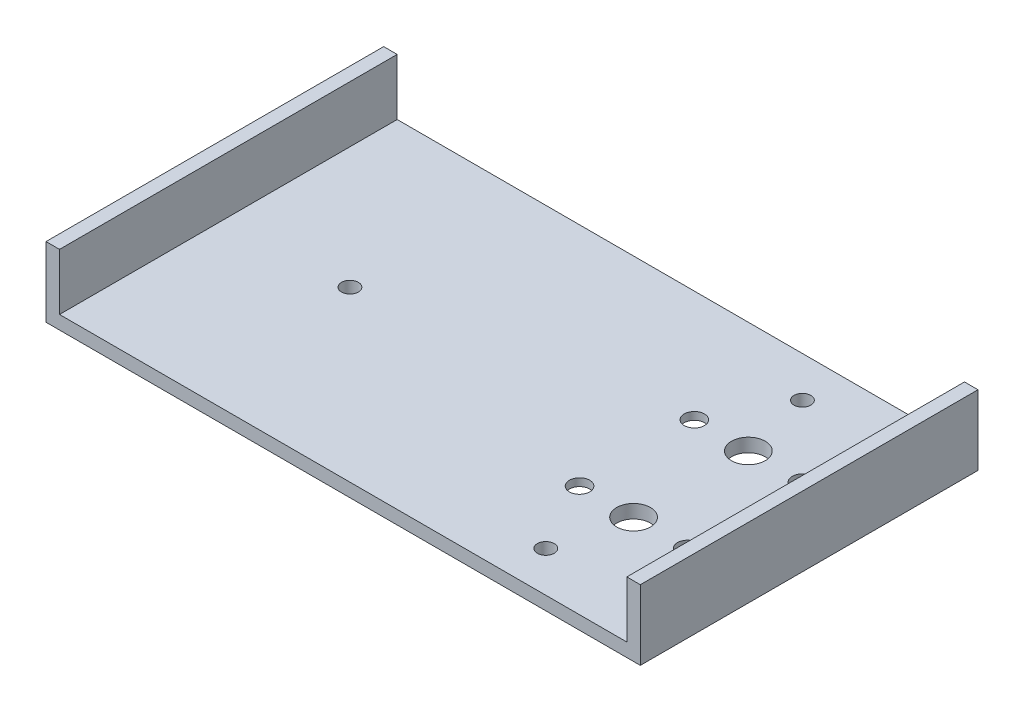
from build123d import *

# Parameters (mm, degrees)
EXTRUDE_1_DEPTH     = 100
SKETCH_2_R          = 5
SKETCH_2_R_2        = 2.5
SKETCH_2_R_3        = 3
CUT_EXTRUDE_1_DEPTH = 4
CHAMFER_3_SIZE      = 3
CHAMFER_3_SIZE2     = 1.732050808
CHAMFER_4_SIZE      = 3
CHAMFER_4_SIZE2     = 1.732050808
CHAMFER_5_SIZE      = 3
CHAMFER_5_SIZE2     = 1.732050808
CHAMFER_6_SIZE      = 3
CHAMFER_6_SIZE2     = 1.732050808


with BuildPart() as part:
    # Эскиз1 → Бобышка-Вытянуть1 (new body)
    with BuildSketch(Plane.XY):
        Polygon((0, 0), (176, 0), (176, 20.7), (172, 20.7), (172, 4), (4, 4), (4, 20.7), (0, 20.7), align=None)
    extrude(amount=EXTRUDE_1_DEPTH)

    # Эскиз2 → Вырез-Вытянуть1 (cut)
    with BuildSketch(Plane.XZ):
        with Locations((141, 67)):
            Circle(SKETCH_2_R)
        with Locations((141, 33)):
            Circle(SKETCH_2_R)
        with Locations((40, 50)):
            Circle(SKETCH_2_R_2)
        with Locations((166, 88)):
            Circle(SKETCH_2_R_2)
        with Locations((136, 88)):
            Circle(SKETCH_2_R_2)
        with Locations((166, 12)):
            Circle(SKETCH_2_R_2)
        with Locations((136, 12)):
            Circle(SKETCH_2_R_2)
        with Locations((157, 33)):
            Circle(SKETCH_2_R_3)
        with Locations((125, 33)):
            Circle(SKETCH_2_R_3)
        with Locations((157, 67)):
            Circle(SKETCH_2_R_3)
        with Locations((125, 67)):
            Circle(SKETCH_2_R_3)
    extrude(amount=-CUT_EXTRUDE_1_DEPTH, mode=Mode.SUBTRACT)

    # Фаска3
    chamfer_3_edges = [part.edges().sort_by_distance(p)[0] for p in [
        (154, 0, 67),
    ]]
    chamfer_3_side = [part.faces().sort_by_distance(p)[0] for p in [
        (86.936555014, 0, 50),
    ]]
    chamfer(chamfer_3_edges, length=CHAMFER_3_SIZE, length2=CHAMFER_3_SIZE2, reference=chamfer_3_side[0])

    # Фаска4
    chamfer_4_edges = [part.edges().sort_by_distance(p)[0] for p in [
        (122, 0, 67),
    ]]
    chamfer_4_side = [part.faces().sort_by_distance(p)[0] for p in [
        (86.589960725, 0, 49.915903323),
    ]]
    chamfer(chamfer_4_edges, length=CHAMFER_4_SIZE, length2=CHAMFER_4_SIZE2, reference=chamfer_4_side[0])

    # Фаска5
    chamfer_5_edges = [part.edges().sort_by_distance(p)[0] for p in [
        (122, 0, 33),
    ]]
    chamfer_5_side = [part.faces().sort_by_distance(p)[0] for p in [
        (86.399006886, 0, 49.83097048),
    ]]
    chamfer(chamfer_5_edges, length=CHAMFER_5_SIZE, length2=CHAMFER_5_SIZE2, reference=chamfer_5_side[0])

    # Фаска6
    chamfer_6_edges = [part.edges().sort_by_distance(p)[0] for p in [
        (154, 0, 33),
    ]]
    chamfer_6_side = [part.faces().sort_by_distance(p)[0] for p in [
        (86.206144924, 0, 49.915062979),
    ]]
    chamfer(chamfer_6_edges, length=CHAMFER_6_SIZE, length2=CHAMFER_6_SIZE2, reference=chamfer_6_side[0])


solid = part.part
